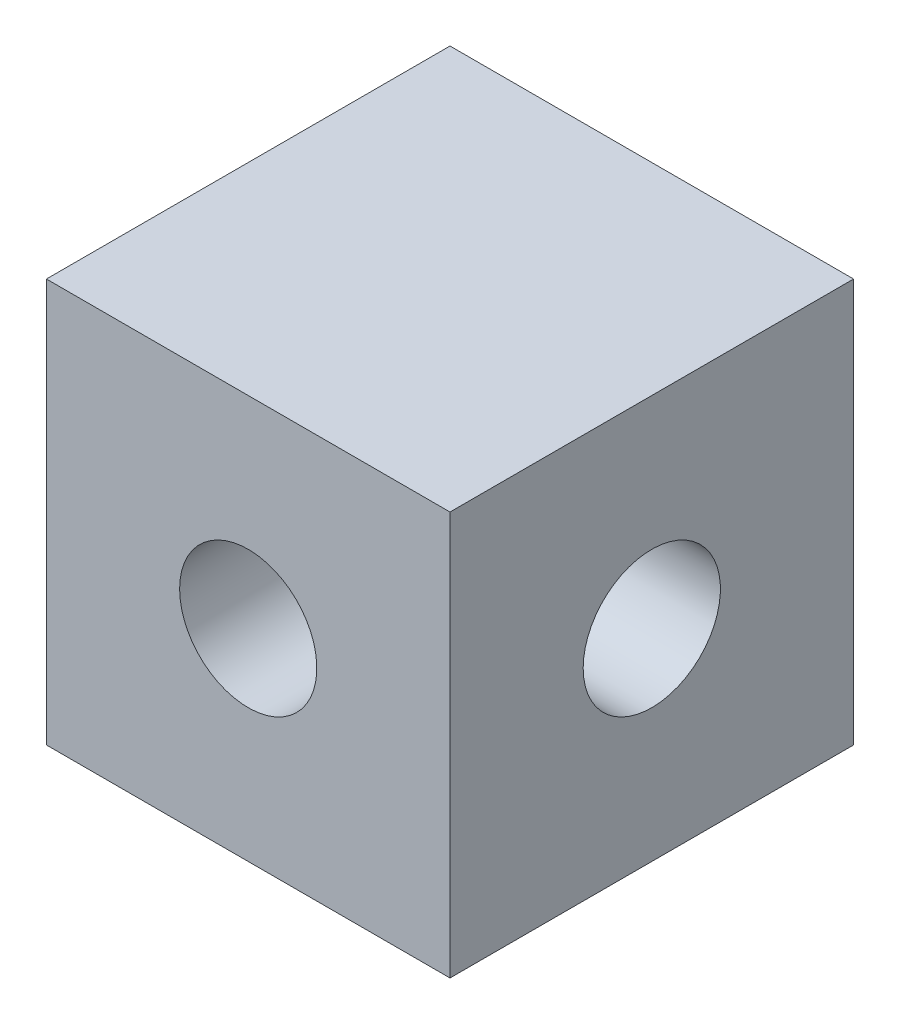
from build123d import *

# Parameters (mm, degrees)
ESQUISSE1_W                  = 10
ESQUISSE1_H                  = 10
BOSS_EXTRU_1_DEPTH           = 10
ESQUISSE2_R                  = 1.5
ENL_V_MAT_EXTRU_1_DEPTH      = 18.320508076
ESQUISSE3_R                  = 1.5
ENL_V_MAT_EXTRU_2_DEPTH      = 18.320508076
D_GAGEMENT_START             = -1
D_GAGEMENT_M31_OUTLINE_R     = 1.7
D_GAGEMENT_M31_OUTLINE_R_2   = 1.5
D_GAGEMENT_M31_DEPTH         = 12
D_GAGEMENT_M31_2_OUTLINE_R   = 1.7
D_GAGEMENT_M31_2_OUTLINE_R_2 = 1.5
D_GAGEMENT_M31_2_DEPTH       = 12


with BuildPart() as part:
    # Esquisse1 → Boss.-Extru.1 (new body)
    with BuildSketch(Plane.XY):
        with Locations((5, 5)):
            Rectangle(ESQUISSE1_W, ESQUISSE1_H)
    extrude(amount=BOSS_EXTRU_1_DEPTH)

    # Esquisse2 → Enlèv. mat.-Extru.1 (cut, through all)
    with BuildSketch(Plane.XY.offset(10)):
        with Locations((5, 5)):
            Circle(ESQUISSE2_R)
    extrude(amount=-ENL_V_MAT_EXTRU_1_DEPTH, mode=Mode.SUBTRACT)

    # Esquisse3 → Enlèv. mat.-Extru.2 (cut, through all)
    with BuildSketch(Plane.ZY):
        with Locations((5, 5)):
            Circle(ESQUISSE3_R)
    extrude(amount=-ENL_V_MAT_EXTRU_2_DEPTH, mode=Mode.SUBTRACT)

    # Dégagement M31: read off the stored shape, not the designer's step
    # Dégagement M31 outline → Dégagement M31 (cut)
    with BuildSketch(Plane.XY.offset(D_GAGEMENT_START)):
        with Locations((5, 5)):
            Circle(D_GAGEMENT_M31_OUTLINE_R)
        with Locations((5, 5)):
            Circle(D_GAGEMENT_M31_OUTLINE_R_2, mode=Mode.SUBTRACT)
    extrude(amount=D_GAGEMENT_M31_DEPTH, mode=Mode.SUBTRACT)

    # D_gagement M31 2 outline → D_gagement M31 2 (cut)
    with BuildSketch(Plane.YZ.offset(D_GAGEMENT_START)):
        with Locations((5, 5)):
            Circle(D_GAGEMENT_M31_2_OUTLINE_R)
        with Locations((5, 5)):
            Circle(D_GAGEMENT_M31_2_OUTLINE_R_2, mode=Mode.SUBTRACT)
    extrude(amount=D_GAGEMENT_M31_2_DEPTH, mode=Mode.SUBTRACT)


solid = part.part
